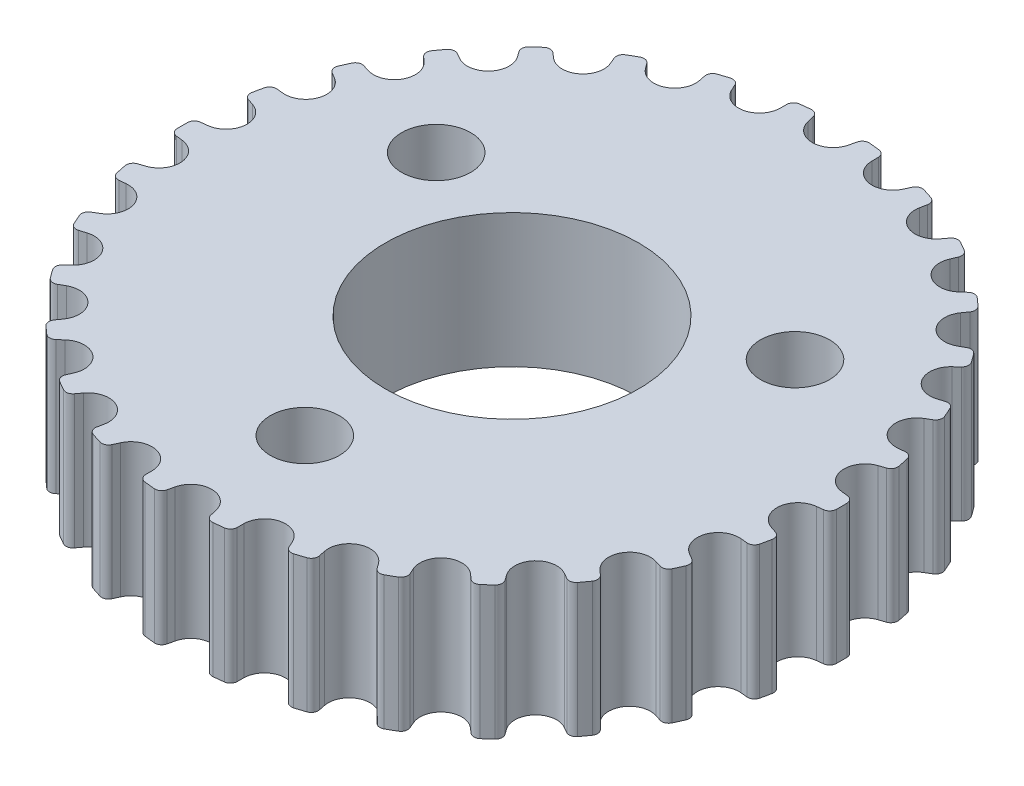
from build123d import *

# Parameters (mm, degrees)
SKETCH1_R           = 14.323944878
BOSS_EXTRUDE1_DEPTH = 5.8
CUT_EXTRUDE1_DEPTH  = 22.07108905
CIRPATTERN1_COUNT   = 30
SKETCH3_R           = 5.5
CUT_EXTRUDE2_DEPTH  = 22.033616305
SKETCH4_R           = 1.5
CUT_EXTRUDE3_DEPTH  = 22.033616305


with BuildPart() as part:
    # Sketch1 → Boss-Extrude1 (new body)
    with BuildSketch(Plane(origin=(0, 0, 0), x_dir=(1, 0, 0), z_dir=(0, 1, 0))):
        Circle(SKETCH1_R)
    extrude(amount=BOSS_EXTRUDE1_DEPTH)

    # Sketch2 → Cut-Extrude1 (cut, through all)
    with BuildSketch(Plane(origin=(0, 5.8, 0), x_dir=(1, 0, 0), z_dir=(0, 1, 0))):
        with BuildLine():
            Line((-0.88830444, 13.756422166), (-0.95, 14.033881093))
            ThreePointArc((-0.95, 14.033881093), (-1.065709647, 14.210883809), (-1.269434594, 14.267583281))
            ThreePointArc((-1.269434594, 14.267583281), (-2.127648488, 14.165045315), (-2.978115599, 14.010932316))
            Line((-2.978115599, 14.010932316), (-2.978115599, 14.323944878))
            Line((-2.978115599, 14.323944878), (2.978115599, 14.323944878))
            Line((2.978115599, 14.323944878), (2.978115599, 14.010932316))
            ThreePointArc((2.978115599, 14.010932316), (2.127648488, 14.165045315), (1.269434594, 14.267583281))
            ThreePointArc((1.269434594, 14.267583281), (1.065709647, 14.210883809), (0.95, 14.033881093))
            Line((0.95, 14.033881093), (0.88830444, 13.756422166))
            ThreePointArc((0.88830444, 13.756422166), (0, 13.043944878), (-0.88830444, 13.756422166))
        make_face()
    cut_extrude1 = extrude(amount=-CUT_EXTRUDE1_DEPTH, mode=Mode.SUBTRACT)

    # CirPattern1: Cut-Extrude1 ×30 about axis
    cirpattern1_axis = Axis((0, 5.8, 0), (0, -1, 0))
    for i in range(1, CIRPATTERN1_COUNT):
        add(cut_extrude1.rotate(cirpattern1_axis, i * 360 / CIRPATTERN1_COUNT), mode=Mode.SUBTRACT)

    # Sketch3 → Cut-Extrude2 (cut, through all)
    with BuildSketch(Plane.XZ):
        Circle(SKETCH3_R)
    extrude(amount=-CUT_EXTRUDE2_DEPTH, mode=Mode.SUBTRACT)

    # Sketch4 → Cut-Extrude3 (cut, through all)
    with BuildSketch(Plane.XZ):
        with Locations((0, 9)):
            Circle(SKETCH4_R)
        with Locations((7.794228634, -4.5)):
            Circle(SKETCH4_R)
        with Locations((-7.794228634, -4.5)):
            Circle(SKETCH4_R)
    extrude(amount=-CUT_EXTRUDE3_DEPTH, mode=Mode.SUBTRACT)


solid = part.part
